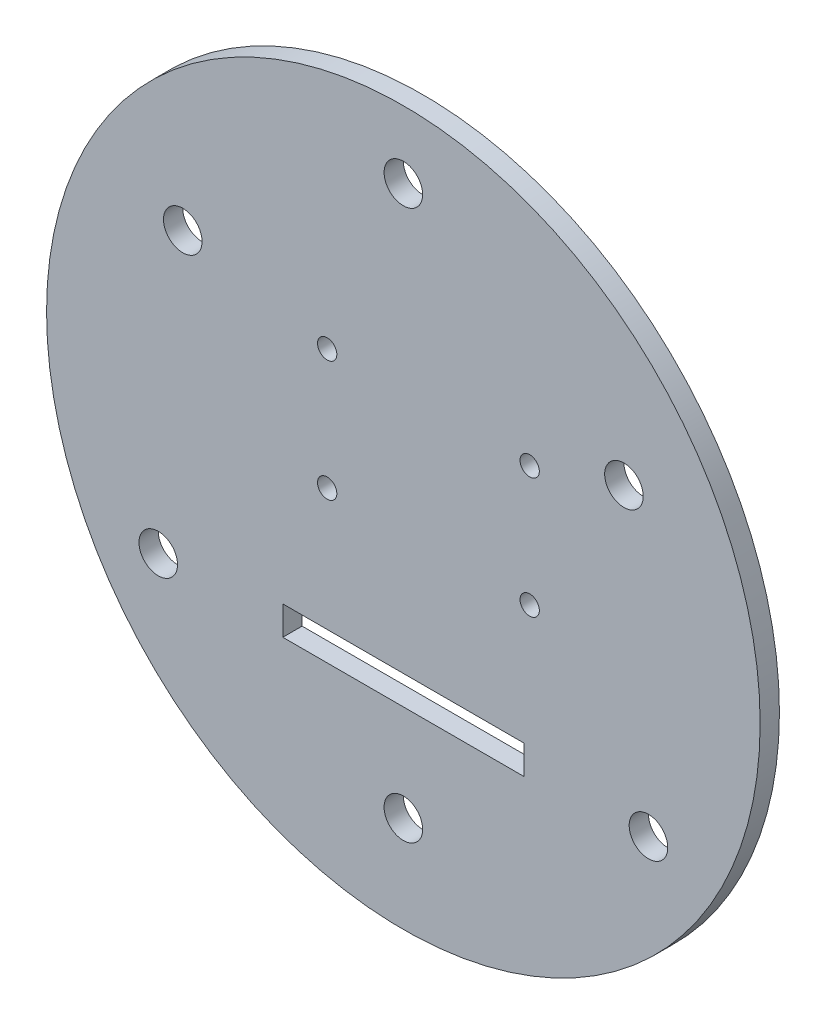
from build123d import *

# Parameters (mm, degrees)
ESQUISSE1_R             = 37
ESQUISSE1_R_2           = 2
ESQUISSE1_W             = 25
ESQUISSE1_H             = 3
BOSS_EXTRU_1_DEPTH      = 2
BOSS_EXTRU_2_DEPTH      = 15
ESQUISSE3_W             = 2
ESQUISSE3_H             = 28.4
BOSS_EXTRU_3_DEPTH      = 2.25
ESQUISSE5_W             = 2
ESQUISSE5_H             = 24.4
BOSS_EXTRU_4_DEPTH      = 2.25
ESQUISSE7_W             = 33.1
ESQUISSE7_H             = 28.4
BOSS_EXTRU_5_DEPTH      = 1
ESQUISSE8_W             = 15
ESQUISSE8_H             = 15
ENL_V_MAT_EXTRU_1_DEPTH = 3
ESQUISSE9_W             = 21
ESQUISSE9_H             = 2.5
ENL_V_MAT_EXTRU_2_DEPTH = 3
ESQUISSE11_W            = 33.1
ESQUISSE11_H            = 28.4
ENL_V_MAT_EXTRU_4_DEPTH = 15
SKETCH1_R               = 1.75
SKETCH1_R_2             = 1
BOSS_EXTRUDE1_DEPTH     = 10
CUT_EXTRUDE1_START      = -10
SKETCH1_3_R             = 1
CUT_EXTRUDE1_DEPTH      = 10


with BuildPart() as part:
    # Esquisse1 → Boss.-Extru.1 (new body)
    with BuildSketch(Plane.XY):
        Circle(ESQUISSE1_R)
        with Locations((0, 30)):
            Circle(ESQUISSE1_R_2, mode=Mode.SUBTRACT)
        with Locations((-22.874807889, 14.34375)):
            Circle(ESQUISSE1_R_2, mode=Mode.SUBTRACT)
        with Locations((-25.416453209, -15.9375)):
            Circle(ESQUISSE1_R_2, mode=Mode.SUBTRACT)
        with Locations((0, -27)):
            Circle(ESQUISSE1_R_2, mode=Mode.SUBTRACT)
        with Locations((25.416453209, -15.9375)):
            Circle(ESQUISSE1_R_2, mode=Mode.SUBTRACT)
        with Locations((22.874807889, 14.34375)):
            Circle(ESQUISSE1_R_2, mode=Mode.SUBTRACT)
        with Locations((0, -15.5)):
            Rectangle(ESQUISSE1_W, ESQUISSE1_H, mode=Mode.SUBTRACT)
    extrude(amount=BOSS_EXTRU_1_DEPTH)

    # Esquisse2 → Boss.-Extru.2 (add)
    with BuildSketch(Plane(origin=(0, 0, 0), x_dir=(-1, 0, 0), z_dir=(0, 0, -1))):
        Polygon((-12.55, 14.9), (-16.55, 14.9), (-16.55, -13.5), (16.55, -13.5), (16.55, 14.9), (12.55, 14.9), (12.55, -9.5), (-12.55, -9.5), align=None)
    extrude(amount=BOSS_EXTRU_2_DEPTH)

    # Esquisse3 → Boss.-Extru.3 (add)
    with BuildSketch(Plane(origin=(-12.55, 0, 0), x_dir=(0, 0, -1), z_dir=(1, 0, 0))):
        with Locations((9.625, 0.7)):
            Rectangle(ESQUISSE3_W, ESQUISSE3_H)
        with Locations((6.625, 0.7)):
            Rectangle(ESQUISSE3_W, ESQUISSE3_H)
    extrude(amount=BOSS_EXTRU_3_DEPTH)

    # Esquisse5 → Boss.-Extru.4 (add)
    with BuildSketch(Plane.ZY.offset(-12.55)):
        with Locations((-9.625, 2.7)):
            Rectangle(ESQUISSE5_W, ESQUISSE5_H)
        with Locations((-6.625, 2.7)):
            Rectangle(ESQUISSE5_W, ESQUISSE5_H)
    extrude(amount=BOSS_EXTRU_4_DEPTH)

    # Esquisse7 → Boss.-Extru.5 (add)
    with BuildSketch(Plane(origin=(0, 0, -15), x_dir=(-1, 0, 0), z_dir=(0, 0, -1))):
        with Locations((0, 0.7)):
            Rectangle(ESQUISSE7_W, ESQUISSE7_H)
    extrude(amount=-BOSS_EXTRU_5_DEPTH)

    # Esquisse8 → Enlèv. mat.-Extru.1 (cut)
    with BuildSketch(Plane(origin=(0, 0, -15), x_dir=(-1, 0, 0), z_dir=(0, 0, -1))):
        Rectangle(ESQUISSE8_W, ESQUISSE8_H)
    extrude(amount=-ENL_V_MAT_EXTRU_1_DEPTH, mode=Mode.SUBTRACT)

    # Esquisse9 → Enlèv. mat.-Extru.2 (cut)
    with BuildSketch(Plane.XZ.offset(13.5)):
        with Locations((0, -5.65)):
            Rectangle(ESQUISSE9_W, ESQUISSE9_H)
    extrude(amount=-ENL_V_MAT_EXTRU_2_DEPTH, mode=Mode.SUBTRACT)

    # Esquisse11 → Enlèv. mat.-Extru.4 (cut)
    with BuildSketch(Plane(origin=(0, 0, -15), x_dir=(-1, 0, 0), z_dir=(0, 0, -1))):
        with Locations((0, 0.7)):
            Rectangle(ESQUISSE11_W, ESQUISSE11_H)
    extrude(amount=-ENL_V_MAT_EXTRU_4_DEPTH, mode=Mode.SUBTRACT)

    # Sketch1 → Boss-Extrude1 (add)
    # profile 1 of 4: a face of its own
    with BuildSketch(Plane(origin=(0, 0, 0), x_dir=(-1, 0, 0), z_dir=(0, 0, -1))):
        with Locations((-13.1, 11.2)):
            Circle(SKETCH1_R)
        with Locations((-13.1, 11.2)):
            Circle(SKETCH1_R_2, mode=Mode.SUBTRACT)
    # profile 2 of 4: a face of its own
    with BuildSketch(Plane(origin=(0, 0, 0), x_dir=(-1, 0, 0), z_dir=(0, 0, -1))):
        with Locations((-13.1, -1.3)):
            Circle(SKETCH1_R)
        with Locations((-13.1, -1.3)):
            Circle(SKETCH1_R_2, mode=Mode.SUBTRACT)
    # profile 3 of 4: a face of its own
    with BuildSketch(Plane(origin=(0, 0, 0), x_dir=(-1, 0, 0), z_dir=(0, 0, -1))):
        with Locations((7.9, 11.2)):
            Circle(SKETCH1_R)
        with Locations((7.9, 11.2)):
            Circle(SKETCH1_R_2, mode=Mode.SUBTRACT)
    # profile 4 of 4: a face of its own
    with BuildSketch(Plane(origin=(0, 0, 0), x_dir=(-1, 0, 0), z_dir=(0, 0, -1))):
        with Locations((7.9, -1.3)):
            Circle(SKETCH1_R)
        with Locations((7.9, -1.3)):
            Circle(SKETCH1_R_2, mode=Mode.SUBTRACT)
    extrude(amount=BOSS_EXTRUDE1_DEPTH)

    # Sketch1<3> → Cut-Extrude1 (cut)
    with BuildSketch(Plane(origin=(0, 0, 0), x_dir=(-1, 0, 0), z_dir=(0, 0, -1)).offset(CUT_EXTRUDE1_START)):
        with Locations((7.9, -1.3)):
            Circle(SKETCH1_3_R)
        with Locations((-13.1, -1.3)):
            Circle(SKETCH1_3_R)
        with Locations((7.9, 11.2)):
            Circle(SKETCH1_3_R)
        with Locations((-13.1, 11.2)):
            Circle(SKETCH1_3_R)
    extrude(amount=CUT_EXTRUDE1_DEPTH, mode=Mode.SUBTRACT)


solid = part.part
